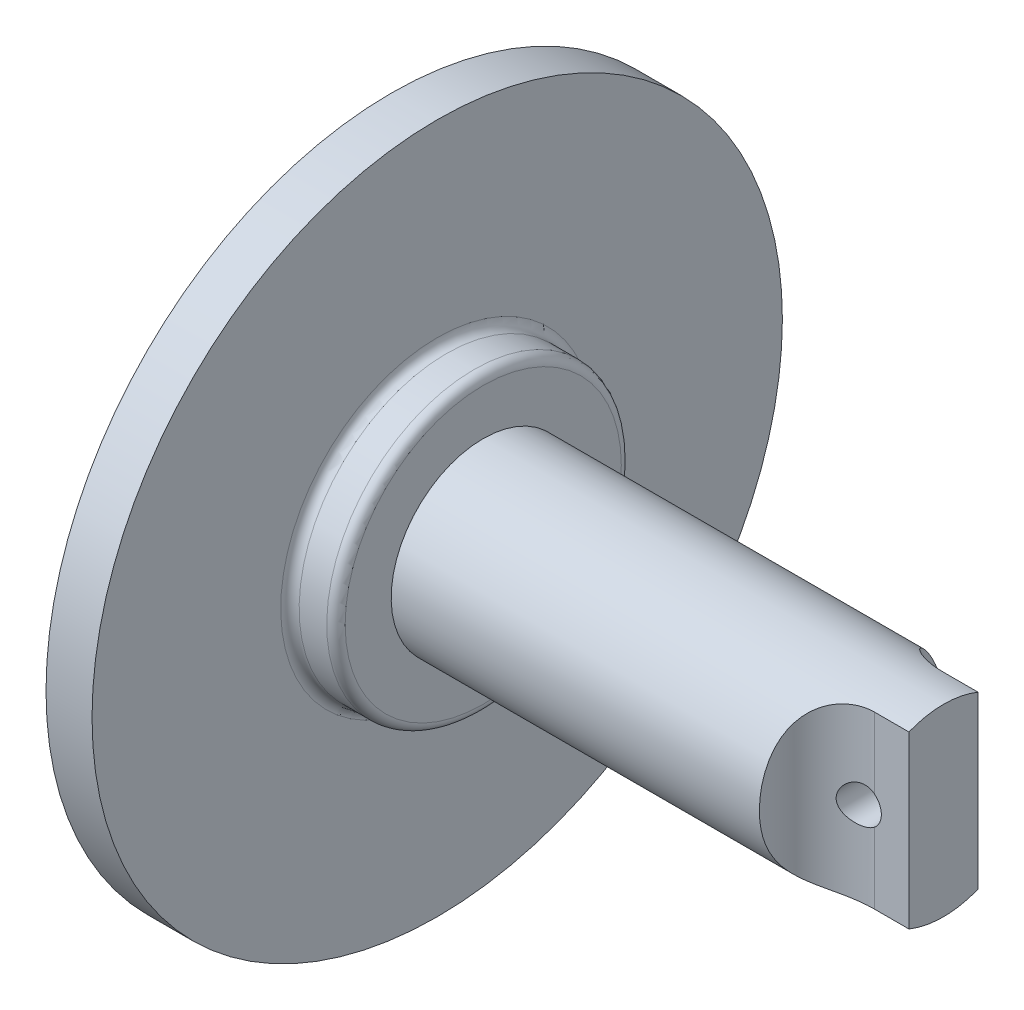
from build123d import *

# Parameters (mm, degrees)
CUT_EXTRUDE1_DEPTH      = 20
FILLET1_R               = 12.5
CUT_EXTRUDE2_DEPTH      = 164.802472582
CUT_EXTRUDE2_DEPTH_BACK = 164.802472582
SKETCH3_R               = 4


with BuildPart() as part:
    # Sketch1 → Revolve1 (revolve)
    with BuildSketch(Plane.XY):
        with BuildLine():
            Line((0, 0), (0, 75))
            Line((0, 75), (10, 75))
            Line((10, 75), (10, 34))
            ThreePointArc((10, 34), (10.585786438, 32.585786438), (12, 32))
            Line((12, 32), (18, 32))
            ThreePointArc((18, 32), (19.414213562, 31.414213562), (20, 30))
            Line((20, 30), (20, 20))
            Line((20, 20), (120, 20))
            Line((120, 20), (120, 0))
            Line((120, 0), (10, 0))
            Line((10, 0), (0, 0))
        make_face()
    revolve(axis=Axis((120, 0, 0), (-1, 0, 0)))

    # Sketch2 → Cut-Extrude1 (cut)
    with BuildSketch(Plane(origin=(120, 0, 0), x_dir=(0, 0, -1), z_dir=(1, 0, 0))):
        with BuildLine():
            Line((-7.5, 18.540496218), (-7.5, -18.540496218))
            ThreePointArc((-7.5, -18.540496218), (-20, 0), (-7.5, 18.540496218))
        make_face()
        with BuildLine():
            Line((7.5, 18.540496218), (7.5, -18.540496218))
            ThreePointArc((7.5, -18.540496218), (20, 0), (7.5, 18.540496218))
        make_face()
    extrude(amount=-CUT_EXTRUDE1_DEPTH, mode=Mode.SUBTRACT)

    # Fillet1
    fillet1_edges = [part.edges().sort_by_distance(p)[0] for p in [
        (100, 0, -7.5),
        (100, 0, 7.5),
    ]]
    fillet(fillet1_edges, radius=FILLET1_R - 0.0001)  # a hair under: the kernel refuses the full size

    # Sketch3 → Cut-Extrude2 (cut, two sides: drawn at the far end of the back side and taken through both)
    with BuildSketch(Plane.XY.offset(7.5).offset(-CUT_EXTRUDE2_DEPTH_BACK)):
        with Locations(Location((110, 0, 0), (0, 0, 308.682187453))):
            Circle(SKETCH3_R)
    extrude(amount=CUT_EXTRUDE2_DEPTH + CUT_EXTRUDE2_DEPTH_BACK, mode=Mode.SUBTRACT)


solid = part.part
